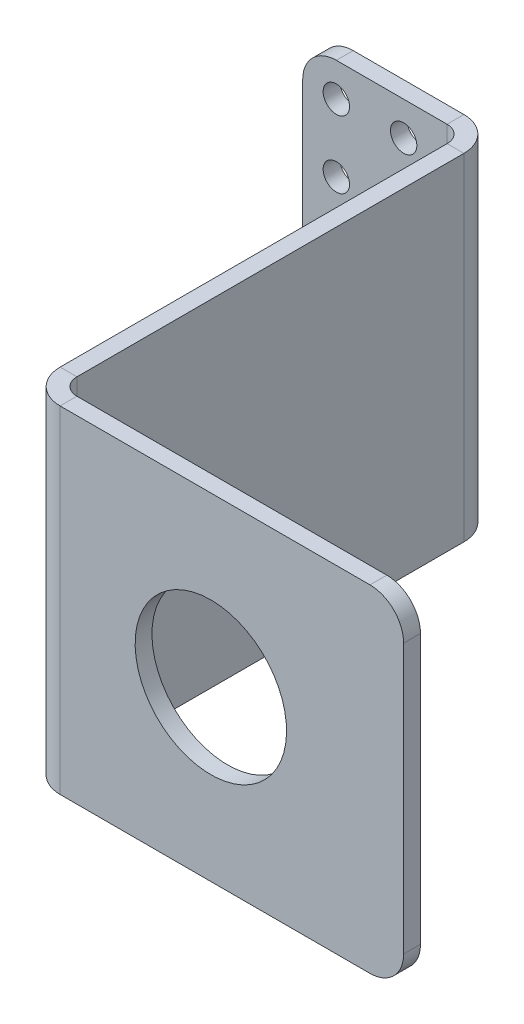
from build123d import *

# Parameters (mm, degrees)
SKETCH1_W           = 101.6
SKETCH1_H           = 63.5
BOSS_EXTRUDE1_DEPTH = 3.175
JOG1_DEPTH          = 63.5
JOG1_2_DEPTH        = 63.5
SKETCH7_R           = 14.2875
CUT_EXTRUDE1_DEPTH  = 146.496778315
SKETCH9_R           = 2.4892
CUT_EXTRUDE2_DEPTH  = 146.496778315
FILLET1_R           = 6.35


# Read off the part's stored shape, not the designer's step: Jog1
with BuildPart() as part:
    # Sketch1 → Boss-Extrude1 (new body)
    with BuildSketch(Plane.XY):
        with Locations((50.8, 31.75)):
            Rectangle(SKETCH1_W, SKETCH1_H)
    extrude(amount=BOSS_EXTRUDE1_DEPTH)

    # Jog1 outline → Jog1 (cut)
    with BuildSketch(Plane(origin=(0, 0, 0), x_dir=(1, 0, 0), z_dir=(0, 1, 0))):
        with BuildLine():
            ThreePointArc((27.247541247, 0), (30.422541247, -0.850738686), (32.746802561, -3.175))
            Line((32.746802561, -3.175), (101.6, -3.175))
            Line((101.6, -3.175), (101.6, 0))
            Line((101.6, 0), (27.247541247, 0))
        make_face()
    extrude(amount=JOG1_DEPTH, mode=Mode.SUBTRACT)

    # Jog1 2 outline → Jog1 2 (add)
    with BuildSketch(Plane(origin=(0, 0, 0), x_dir=(1, 0, 0), z_dir=(0, 1, 0))):
        with BuildLine():
            ThreePointArc((36.772541247, -82.55), (34.527477217, -81.62006403), (33.597541247, -79.375))
            Line((33.597541247, -79.375), (33.597541247, -6.35))
            ThreePointArc((33.597541247, -6.35), (33.381170244, -4.706499064), (32.746802561, -3.175))
            Line((32.746802561, -3.175), (27.247541247, -3.175))
            ThreePointArc((27.247541247, -3.175), (29.492605277, -4.10493597), (30.422541247, -6.35))
            Line((30.422541247, -6.35), (30.422541247, -79.375))
            ThreePointArc((30.422541247, -79.375), (32.282413186, -83.865128061), (36.772541247, -85.725))
            Line((36.772541247, -85.725), (101.6, -85.725))
            Line((101.6, -85.725), (101.6, -82.55))
            Line((101.6, -82.55), (36.772541247, -82.55))
        make_face()
    extrude(amount=JOG1_2_DEPTH)

    # Sketch7 → Cut-Extrude1 (cut, through all)
    with BuildSketch(Plane(origin=(0, 0, 82.55), x_dir=(-1, 0, 0), z_dir=(0, 0, -1))):
        with Locations(Location((-65.220541247, 31.75, 0), (0, 0, 90))):
            Circle(SKETCH7_R)
    extrude(amount=-CUT_EXTRUDE1_DEPTH, mode=Mode.SUBTRACT)

    # Sketch9 → Cut-Extrude2 (cut, through all)
    with BuildSketch(Plane.XY.offset(3.175)):
        with Locations((6.35, 57.15)):
            Circle(SKETCH9_R)
        with Locations(Location((19.05, 57.15, 0), (0, 0, 180))):
            Circle(SKETCH9_R)
        with Locations((6.35, 44.45)):
            Circle(SKETCH9_R)
        with Locations(Location((19.05, 44.45, 0), (0, 0, 180))):
            Circle(SKETCH9_R)
        with Locations((6.35, 31.75)):
            Circle(SKETCH9_R)
        with Locations(Location((19.05, 31.75, 0), (0, 0, 180))):
            Circle(SKETCH9_R)
        with Locations((6.35, 19.05)):
            Circle(SKETCH9_R)
        with Locations(Location((19.05, 19.05, 0), (0, 0, 180))):
            Circle(SKETCH9_R)
        with Locations((6.35, 6.35)):
            Circle(SKETCH9_R)
        with Locations(Location((19.05, 6.35, 0), (0, 0, 180))):
            Circle(SKETCH9_R)
    extrude(amount=-CUT_EXTRUDE2_DEPTH, mode=Mode.SUBTRACT)

    # Fillet1
    fillet1_edges = [part.edges().sort_by_distance(p)[0] for p in [
        (101.6, 63.5, 84.1375),
        (101.6, 0, 84.1375),
        (0, 0, 1.5875),
        (0, 63.5, 1.5875),
    ]]
    fillet(fillet1_edges, radius=FILLET1_R)


solid = part.part
